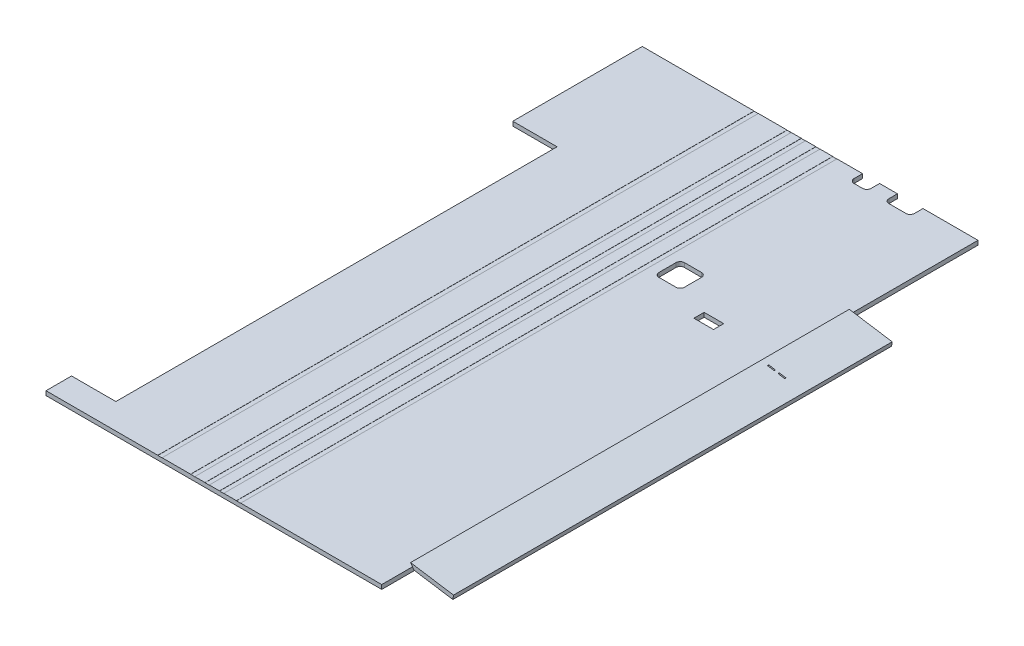
from build123d import *

# Parameters (mm, degrees)
TRAGFL_CHEGRUNDFORM_DEPTH                    = 700
ABWICKELN1_DEPTH                             = 700
ABWICKELN1_2_DEPTH                           = 700
ABBIEGEN1_DEPTH                              = 700
ABBIEGEN1_2_DEPTH                            = 700
QUERRUDER_DEPTH                              = 5
FASE1_SIZE                                   = 5
SKIZZE9_W                                    = 20
SKIZZE9_H                                    = 15
KABELDURCHBRUCHRUMPF_DEPTH                   = 5
VERRUNDUNG1_R                                = 5
SKIZZE10_W                                   = 30
SKIZZE10_H                                   = 30
KABELDURCHBRUCHMOTOR_DEPTH                   = 5
VERRUNDUNG2_R                                = 5
SKIZZE11_W                                   = 30
SKIZZE11_H                                   = 15
SCHNITT_LINEAR_AUSTRAGEN1_DEPTH              = 5
KABELDURCHBURCHSERVOS_R                      = 5
SKIZZE12_W                                   = 23
SKIZZE12_H                                   = 12
SERVODURCHBRUCH_DEPTH                        = 10
SKIZZE13_W                                   = 8
SKIZZE13_H                                   = 1.5
SCHNITT_LINEAR_AUSTRAGEN2_DEPTH              = 752.378951978
SCHNITT_LINEAR_AUSTRAGEN_D_NN2_DEPTH         = 700
SCHNITT_LINEAR_AUSTRAGEN_D_NN2_2_OUTLINE_W   = 52
SCHNITT_LINEAR_AUSTRAGEN_D_NN2_2_OUTLINE_H   = 5
SCHNITT_LINEAR_AUSTRAGEN_D_NN2_2_DEPTH       = 152
SCHNITT_LINEAR_AUSTRAGEN_D_NN2_START         = 670
SCHNITT_LINEAR_AUSTRAGEN_D_NN2_3_OUTLINE_W   = 52
SCHNITT_LINEAR_AUSTRAGEN_D_NN2_3_OUTLINE_H   = 5
SCHNITT_LINEAR_AUSTRAGEN_D_NN2_3_DEPTH       = 30
SCHNITT_LINEAR_AUSTRAGEN_D_NN2_4_DEPTH       = 700
SCHNITT_LINEAR_AUSTRAGEN_D_NN2_START_2       = -12.152804342
SCHNITT_LINEAR_AUSTRAGEN_D_NN2_5_OUTLINE_W   = 179.426586231
SCHNITT_LINEAR_AUSTRAGEN_D_NN2_5_OUTLINE_H   = 700
SCHNITT_LINEAR_AUSTRAGEN_D_NN2_5_DEPTH       = 4.8
SCHNITT_LINEAR_AUSTRAGEN_D_NN2_START_3       = -7.352804342
SCHNITT_LINEAR_AUSTRAGEN_D_NN2_6_OUTLINE_W   = 79.274946575
SCHNITT_LINEAR_AUSTRAGEN_D_NN2_6_OUTLINE_H   = 700
SCHNITT_LINEAR_AUSTRAGEN_D_NN2_6_OUTLINE_W_2 = 11.998027887
SCHNITT_LINEAR_AUSTRAGEN_D_NN2_6_OUTLINE_W_3 = 14.873170005
SCHNITT_LINEAR_AUSTRAGEN_D_NN2_6_DEPTH       = 0.2


with BuildPart() as part:
    # TragflächeGrundform: read off the stored shape, not the designer's step
    # TragflächeGrundform outline → TragflächeGrundform (new body)
    with BuildSketch(Plane.XY):
        Polygon((141.694514104, 8.347195658), (273.694514104, -12.152804342), (274.46183092, -7.212032651), (142.080458395, 13.347195658), (103.267684057, 13.347195658), (86.110620432, 10.396432289), (69.585407633, 5.027065166), (35.868015254, -12.152804342), (221.694514104, -12.152804342), (221.694514104, -7.152804342), (56.694514104, -7.152804342), (71.504741461, 0.393383409), (87.313114186, 5.529835073), (103.694514104, 8.347195658), align=None)
    extrude(amount=TRAGFL_CHEGRUNDFORM_DEPTH)

    # Abwickeln1: read off the stored shape, not the designer's step
    # Abwickeln1 outline → Abwickeln1 (cut)
    with BuildSketch(Plane.XY):
        Polygon((69.585407633, 5.027065166), (45.681067781, -7.152804342), (56.694514104, -7.152804342), (71.504741461, 0.393383409), (87.313114186, 5.529835073), (103.694514104, 8.347195658), (141.694514104, 8.347195658), (273.694514104, -12.152804342), (274.46183092, -7.212032651), (142.080458395, 13.347195658), (103.267684057, 13.347195658), (86.110620432, 10.396432289), align=None)
    extrude(amount=ABWICKELN1_DEPTH, mode=Mode.SUBTRACT)

    # Abwickeln1 2 outline → Abwickeln1 2 (add)
    with BuildSketch(Plane.XY):
        Polygon((45.681067781, -7.152804342), (-172.426586231, -7.152804342), (-172.426586231, -12.152804342), (35.868015254, -12.152804342), align=None)
    extrude(amount=ABWICKELN1_2_DEPTH)

    # Abbiegen1: read off the stored shape, not the designer's step
    # Abbiegen1 outline → Abbiegen1 (cut)
    with BuildSketch(Plane.XY):
        with BuildLine():
            ThreePointArc((57.111044081, -12.152804342), (53.540329867, -10.694232633), (52.012024567, -7.152804342))
            Line((52.012024567, -7.152804342), (-172.426586231, -7.152804342))
            Line((-172.426586231, -7.152804342), (-172.426586231, -12.152804342))
            Line((-172.426586231, -12.152804342), (57.111044081, -12.152804342))
        make_face()
    extrude(amount=ABBIEGEN1_DEPTH, mode=Mode.SUBTRACT)

    # Abbiegen1 2 outline → Abbiegen1 2 (add)
    with BuildSketch(Plane.XY):
        with BuildLine():
            Line((141.702141554, 8.346011092), (273.694514104, -12.152804342))
            Line((273.694514104, -12.152804342), (274.46183092, -7.212032651))
            Line((274.46183092, -7.212032651), (142.46945837, 13.286782783))
            ThreePointArc((142.46945837, 13.286782783), (142.079290863, 13.332070009), (141.686795218, 13.347195658))
            Line((141.686795218, 13.347195658), (103.703050705, 13.347195658))
            ThreePointArc((103.703050705, 13.347195658), (103.269261775, 13.328713853), (102.838616847, 13.273402389))
            Line((102.838616847, 13.273402389), (86.472730203, 10.45870986))
            ThreePointArc((86.472730203, 10.45870986), (86.113791213, 10.383599863), (85.76117739, 10.282891362))
            Line((85.76117739, 10.282891362), (69.967141466, 5.151098007))
            ThreePointArc((69.967141466, 5.151098007), (69.591442632, 5.01249539), (69.227776589, 4.844843047))
            Line((69.227776589, 4.844843047), (54.795692532, -2.508671069))
            ThreePointArc((54.795692532, -2.508671069), (52.736662064, -4.430823798), (52.012024567, -7.152804342))
            Line((52.012024567, -7.152804342), (57.111044081, -7.152804342))
            ThreePointArc((57.111044081, -7.152804342), (57.013807089, -7.076148878), (57.065645031, -6.963703689))
            Line((57.065645031, -6.963703689), (71.497729087, 0.389810426))
            ThreePointArc((71.497729087, 0.389810426), (71.504859794, 0.393097727), (71.512226438, 0.395815426))
            Line((71.512226438, 0.395815426), (87.306262362, 5.52760878))
            ThreePointArc((87.306262362, 5.52760878), (87.313176358, 5.529583457), (87.320214378, 5.531056202))
            Line((87.320214378, 5.531056202), (103.686101021, 8.345748731))
            ThreePointArc((103.686101021, 8.345748731), (103.694545039, 8.34683327), (103.703050705, 8.347195658))
            Line((103.703050705, 8.347195658), (141.686795218, 8.347195658))
            ThreePointArc((141.686795218, 8.347195658), (141.694491211, 8.346899077), (141.702141554, 8.346011092))
        make_face()
    extrude(amount=ABBIEGEN1_2_DEPTH)

    # Skizze8 → Querruder (cut)
    with BuildSketch(Plane(origin=(5.370179419, 34.578716257, 0), x_dir=(0.9881543382363094, -0.15346336313518455, 0), z_dir=(0.15346336313518455, 0.9881543382363094, 0))):
        Polygon((272.317431689, -670), (220.317431689, -670), (220.317431689, -418.5), (220.317431689, -358.002851525), (220.317431689, -152), (272.317431689, -152), (272.317431689, -153.5), (221.317431689, -153.5), (221.317431689, -668.5), (272.317431689, -668.5), align=None)
    extrude(amount=-QUERRUDER_DEPTH, mode=Mode.SUBTRACT)


with BuildPart() as querruder_piece_1:
    # of the separate pieces the step leaves, piece 1, a body of its own (querruder_pieces)
    add(part.part.solids().sort_by_distance((221.694514104, -12.152804342, 0))[0])

    # Skizze9 → KabeldurchbruchRumpf (cut)
    with BuildSketch(Plane.XZ.offset(12.152804342)):
        with Locations((96.176970849, 7.5)):
            Rectangle(SKIZZE9_W, SKIZZE9_H)
    extrude(amount=-KABELDURCHBRUCHRUMPF_DEPTH, mode=Mode.SUBTRACT)

    # Verrundung1
    verrundung1_edges = [querruder_piece_1.edges().sort_by_distance(p)[0] for p in [
        (86.176970849, -9.652804342, 15),
        (106.176970849, -9.652804342, 15),
    ]]
    fillet(verrundung1_edges, radius=VERRUNDUNG1_R)

    # Skizze10 → KabeldurchbruchMotor (cut)
    with BuildSketch(Plane.XZ.offset(12.152804342)):
        with Locations((82.111044081, 210)):
            Rectangle(SKIZZE10_W, SKIZZE10_H)
    extrude(amount=-KABELDURCHBRUCHMOTOR_DEPTH, mode=Mode.SUBTRACT)

    # Verrundung2
    verrundung2_edges = [querruder_piece_1.edges().sort_by_distance(p)[0] for p in [
        (67.111044081, -9.652804342, 195),
        (67.111044081, -9.652804342, 225),
        (97.111044081, -9.652804342, 225),
        (97.111044081, -9.652804342, 195),
    ]]
    fillet(verrundung2_edges, radius=VERRUNDUNG2_R)

    # Skizze11 → Schnitt-Linear austragen1 (cut)
    with BuildSketch(Plane.XZ.offset(12.152804342)):
        with Locations((142.111044081, 7.5)):
            Rectangle(SKIZZE11_W, SKIZZE11_H)
    extrude(amount=-SCHNITT_LINEAR_AUSTRAGEN1_DEPTH, mode=Mode.SUBTRACT)

    # KabeldurchburchServos
    kabeldurchburchservos_edges = [querruder_piece_1.edges().sort_by_distance(p)[0] for p in [
        (127.111044081, -9.652804342, 15),
        (157.111044081, -9.652804342, 15),
    ]]
    fillet(kabeldurchburchservos_edges, radius=KABELDURCHBURCHSERVOS_R)

    # Skizze12 → ServoDurchbruch (cut)
    with BuildSketch(Plane.XZ.offset(12.152804342)):
        with Locations((145.686101021, 240)):
            Rectangle(SKIZZE12_W, SKIZZE12_H)
    extrude(amount=-SERVODURCHBRUCH_DEPTH, mode=Mode.SUBTRACT)

    # Schnitt-Linear-Austragen-Dünn2: read off the stored shape, not the designer's step
    # Schnitt-Linear-Austragen-Dünn2 outline → Schnitt-Linear-Austragen-Dünn2 (cut)
    with BuildSketch(Plane.XY):
        Polygon((274.46183092, -7.212032651), (223.077805331, 0.768062232), (222.310488516, -4.172709459), (273.694514104, -12.152804342), align=None)
    extrude(amount=SCHNITT_LINEAR_AUSTRAGEN_D_NN2_DEPTH, mode=Mode.SUBTRACT)

    # Schnitt-Linear-Austragen-D_nn2 2 outline → Schnitt-Linear-Austragen-D_nn2 2 (add)
    with BuildSketch(Plane.XY):
        with Locations((-146.426586231, -9.652804342)):
            Rectangle(SCHNITT_LINEAR_AUSTRAGEN_D_NN2_2_OUTLINE_W, SCHNITT_LINEAR_AUSTRAGEN_D_NN2_2_OUTLINE_H)
    extrude(amount=SCHNITT_LINEAR_AUSTRAGEN_D_NN2_2_DEPTH)

    # Schnitt-Linear-Austragen-D_nn2 3 outline → Schnitt-Linear-Austragen-D_nn2 3 (add)
    with BuildSketch(Plane.XY.offset(SCHNITT_LINEAR_AUSTRAGEN_D_NN2_START)):
        with Locations((-146.426586231, -9.652804342)):
            Rectangle(SCHNITT_LINEAR_AUSTRAGEN_D_NN2_3_OUTLINE_W, SCHNITT_LINEAR_AUSTRAGEN_D_NN2_3_OUTLINE_H)
    extrude(amount=SCHNITT_LINEAR_AUSTRAGEN_D_NN2_3_DEPTH)

    # Schnitt-Linear-Austragen-D_nn2 4 outline → Schnitt-Linear-Austragen-D_nn2 4 (cut)
    with BuildSketch(Plane.XY):
        with BuildLine():
            ThreePointArc((54.795692532, -2.508671069), (52.686053369, -4.517166908), (52.019875256, -7.352804342))
            Line((52.019875256, -7.352804342), (56.139584199, -7.352804342))
            Line((56.139584199, -7.352804342), (56.139584199, -7.152804342))
            Line((56.139584199, -7.152804342), (57.111044081, -7.152804342))
            ThreePointArc((57.111044081, -7.152804342), (57.013807089, -7.076148878), (57.065645031, -6.963703689))
            Line((57.065645031, -6.963703689), (71.497729087, 0.389810426))
            ThreePointArc((71.497729087, 0.389810426), (71.504859794, 0.393097727), (71.512226438, 0.395815426))
            Line((71.512226438, 0.395815426), (87.306262362, 5.52760878))
            ThreePointArc((87.306262362, 5.52760878), (87.313176358, 5.529583457), (87.320214378, 5.531056202))
            Line((87.320214378, 5.531056202), (103.686101021, 8.345748731))
            ThreePointArc((103.686101021, 8.345748731), (103.694545039, 8.34683327), (103.703050705, 8.347195658))
            Line((103.703050705, 8.347195658), (141.686795218, 8.347195658))
            ThreePointArc((141.686795218, 8.347195658), (141.694491211, 8.346899077), (141.702141554, 8.346011092))
            Line((141.702141554, 8.346011092), (222.310488516, -4.172709459))
            Line((222.310488516, -4.172709459), (223.077805331, 0.768062232))
            Line((223.077805331, 0.768062232), (142.46945837, 13.286782783))
            ThreePointArc((142.46945837, 13.286782783), (142.079290863, 13.332070009), (141.686795218, 13.347195658))
            Line((141.686795218, 13.347195658), (103.703050705, 13.347195658))
            ThreePointArc((103.703050705, 13.347195658), (103.269261775, 13.328713853), (102.838616847, 13.273402389))
            Line((102.838616847, 13.273402389), (86.472730203, 10.45870986))
            ThreePointArc((86.472730203, 10.45870986), (86.113791213, 10.383599863), (85.76117739, 10.282891362))
            Line((85.76117739, 10.282891362), (69.967141466, 5.151098007))
            ThreePointArc((69.967141466, 5.151098007), (69.591442632, 5.01249539), (69.227776589, 4.844843047))
            Line((69.227776589, 4.844843047), (54.795692532, -2.508671069))
        make_face()
    extrude(amount=SCHNITT_LINEAR_AUSTRAGEN_D_NN2_4_DEPTH, mode=Mode.SUBTRACT)

    # Schnitt-Linear-Austragen-D_nn2 5 outline → Schnitt-Linear-Austragen-D_nn2 5 (add)
    with BuildSketch(Plane(origin=(0, 0, 0), x_dir=(1, 0, 0), z_dir=(0, 1, 0)).offset(SCHNITT_LINEAR_AUSTRAGEN_D_NN2_START_2)):
        with Locations((-30.713293115, -350)):
            Rectangle(SCHNITT_LINEAR_AUSTRAGEN_D_NN2_5_OUTLINE_W, SCHNITT_LINEAR_AUSTRAGEN_D_NN2_5_OUTLINE_H)
    extrude(amount=SCHNITT_LINEAR_AUSTRAGEN_D_NN2_5_DEPTH)

    # Schnitt-Linear-Austragen-D_nn2 6 outline → Schnitt-Linear-Austragen-D_nn2 6 (add)
    with BuildSketch(Plane(origin=(0, 0, 0), x_dir=(1, 0, 0), z_dir=(0, 1, 0)).offset(SCHNITT_LINEAR_AUSTRAGEN_D_NN2_START_3)):
        with Locations((-80.789112944, -350)):
            Rectangle(SCHNITT_LINEAR_AUSTRAGEN_D_NN2_6_OUTLINE_W, SCHNITT_LINEAR_AUSTRAGEN_D_NN2_6_OUTLINE_H)
        Polygon((-36.151639656, 0), (-36.151639656, -700), (-0.246186452, -700), (-2.746186296, -699.999120763), (-2.500000155, 0), align=None)
        Polygon((2.499999845, -0.000879237), (2.253813704, -700), (14.268386307, -700), (14.268386307, 0), (-1.26e-07, 0), align=None)
        with Locations((25.267400251, -350)):
            Rectangle(SCHNITT_LINEAR_AUSTRAGEN_D_NN2_6_OUTLINE_W_2, SCHNITT_LINEAR_AUSTRAGEN_D_NN2_6_OUTLINE_H)
        with Locations((43.702999197, -350)):
            Rectangle(SCHNITT_LINEAR_AUSTRAGEN_D_NN2_6_OUTLINE_W_3, SCHNITT_LINEAR_AUSTRAGEN_D_NN2_6_OUTLINE_H)
    extrude(amount=SCHNITT_LINEAR_AUSTRAGEN_D_NN2_6_DEPTH)


with BuildPart() as querruder_piece_2:
    # of the separate pieces the step leaves, piece 2, a body of its own (querruder_pieces)
    add(part.part.solids().sort_by_distance((273.694514104, -12.152804342, 153.5))[0])

    # Fase1
    fase1_edges = [querruder_piece_2.edges().sort_by_distance(p)[0] for p in [
        (223.298642854, -4.326172822, 411),
    ]]
    chamfer(fase1_edges, length=FASE1_SIZE - 0.0001)  # a hair under: the kernel refuses the full size

    # Skizze13 → Schnitt-Linear austragen2 (cut, through all)
    with BuildSketch(Plane(origin=(4.602862603, 29.637944565, 0), x_dir=(0.9881543382363094, -0.15346336313518452, 0), z_dir=(-0.15346336313518452, -0.9881543382363095, 0))):
        with Locations((233.317431689, 256.75)):
            Rectangle(SKIZZE13_W, SKIZZE13_H)
        with Locations((245.817431689, 256.75)):
            Rectangle(SKIZZE13_W, SKIZZE13_H)
    extrude(amount=-SCHNITT_LINEAR_AUSTRAGEN2_DEPTH, mode=Mode.SUBTRACT)


solid = Compound([querruder_piece_1.part, querruder_piece_2.part])
